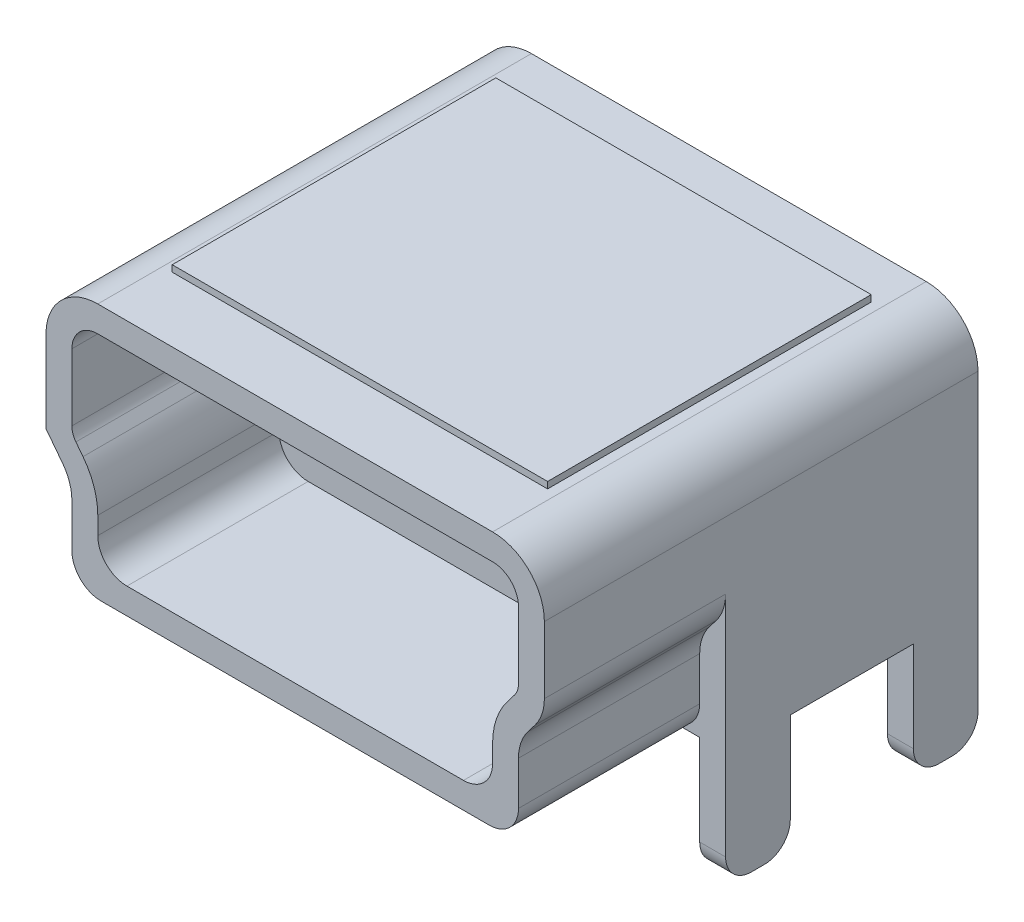
from build123d import *

# Parameters (mm, degrees)
SKETCH1_W              = 7.7
SKETCH1_H              = 6.7
BOSS_EXTRUDE1_DEPTH    = 3.95
SKETCH2_W              = 0.4
SKETCH2_H              = 1
BOSS_EXTRUDE2_DEPTH    = 1.8
FILLET1_R              = 0.4
LPATTERN1_COUNT        = 2
LPATTERN1_PITCH        = 2.9
FILLET1_OF_LPATTERN1_R = 0.4
FILLET2_R              = 0.8
CUT_EXTRUDE1_DEPTH     = 2.8
FILLET3_R              = 0.45
FILLET4_R              = 0.7
CUT_EXTRUDE2_DEPTH     = 2.8
MIRROR3_START          = 0.55
MIRROR3_DEPTH          = 2.8
MIRROR3_START_2        = -2.95
MIRROR3_2_OUTLINE_W    = 0.4
MIRROR3_2_OUTLINE_H    = 1.8
MIRROR3_2_DEPTH        = 0.2
MIRROR3_START_3        = -0.05
MIRROR3_3_OUTLINE_W    = 0.4
MIRROR3_3_OUTLINE_H    = 1.8
MIRROR3_3_DEPTH        = 0.2
MIRROR3_START_4        = -3.85
MIRROR3_4_DEPTH        = 0.4
SKETCH5_W              = 5.8
SKETCH5_H              = 5
BOSS_EXTRUDE3_DEPTH    = 0.1


with BuildPart() as part:
    # Sketch1 → Boss-Extrude1 (new body)
    with BuildSketch(Plane(origin=(0, 0, 0), x_dir=(1, 0, 0), z_dir=(0, 1, 0))):
        Rectangle(SKETCH1_W, SKETCH1_H)
    extrude(amount=BOSS_EXTRUDE1_DEPTH)

    # Sketch2 → Boss-Extrude2 (add)
    with BuildSketch(Plane.XZ):
        with Locations((3.65, -2.85)):
            Rectangle(SKETCH2_W, SKETCH2_H)
    boss_extrude2 = extrude(amount=BOSS_EXTRUDE2_DEPTH)

    # Fillet1
    fillet1_edges = [part.edges().sort_by_distance(p)[0] for p in [
        (3.65, -1.8, -2.35),
        (3.65, -1.8, -3.35),
    ]]
    fillet(fillet1_edges, radius=FILLET1_R)

    # LPattern1: Boss-Extrude2 ×2
    with Locations(*[(0, 0, i * LPATTERN1_PITCH) for i in range(1, LPATTERN1_COUNT)]):
        add(boss_extrude2)

    # Fillet1 of LPattern1
    fillet1_of_lpattern1_edges = [part.edges().sort_by_distance(p)[0] for p in [
        (3.65, -1.8, 0.55),
        (3.65, -1.8, -0.45),
    ]]
    fillet(fillet1_of_lpattern1_edges, radius=FILLET1_OF_LPATTERN1_R)

    # Fillet2
    fillet2_edges = [part.edges().sort_by_distance(p)[0] for p in [
        (3.85, 3.95, 0),
        (-3.85, 3.95, 0),
    ]]
    fillet(fillet2_edges, radius=FILLET2_R)

    # Sketch3 → Cut-Extrude1 (cut)
    with BuildSketch(Plane.XY.offset(3.35)):
        Polygon((3.85, 1.36), (3.85, 1.88), (3.45, 1.36), (3.45, 0), (3.85, 0), align=None)
    extrude(amount=-CUT_EXTRUDE1_DEPTH, mode=Mode.SUBTRACT)

    # Fillet3
    fillet3_edges = [part.edges().sort_by_distance(p)[0] for p in [
        (3.45, 0, 1.95),
    ]]
    fillet(fillet3_edges, radius=FILLET3_R)

    # Fillet4
    fillet4_edges = [part.edges().sort_by_distance(p)[0] for p in [
        (3.45, 1.36, 1.95),
        (3.85, 1.88, 1.95),
    ]]
    fillet(fillet4_edges, radius=FILLET4_R)

    # Sketch4 → Cut-Extrude2 (cut)
    with BuildSketch(Plane.XY.offset(3.35)):
        with BuildLine():
            Line((0, 0.4), (0, 3.55))
            Line((0, 3.55), (3.05, 3.55))
            ThreePointArc((3.05, 3.55), (3.332842712, 3.432842712), (3.45, 3.15))
            Line((3.45, 3.15), (3.45, 2.118085363))
            ThreePointArc((3.45, 2.118085363), (3.434021266, 2.021483497), (3.387787197, 1.935172134))
            Line((3.387787197, 1.935172134), (3.278113612, 1.792596474))
            ThreePointArc((3.278113612, 1.792596474), (3.108588692, 1.476121479), (3.05, 1.121914637))
            Line((3.05, 1.121914637), (3.05, 0.85))
            ThreePointArc((3.05, 0.85), (2.918198052, 0.531801948), (2.6, 0.4))
            Line((2.6, 0.4), (0, 0.4))
        make_face()
    extrude(amount=-CUT_EXTRUDE2_DEPTH, mode=Mode.SUBTRACT)

    # Mirror3: read off the stored shape, not the designer's step
    # Mirror3 outline → Mirror3 (cut)
    with BuildSketch(Plane.XY.offset(MIRROR3_START)):
        with BuildLine():
            Line((-3.85, 1.88), (-3.85, 0))
            Line((-3.85, 0), (-3, 0))
            ThreePointArc((-3, 0), (-3.318198052, 0.131801948), (-3.45, 0.45))
            Line((-3.45, 0.45), (-3.45, 1.121914637))
            ThreePointArc((-3.45, 1.121914637), (-3.487283713, 1.347318991), (-3.595163208, 1.54871217))
            Line((-3.595163208, 1.54871217), (-3.85, 1.88))
        make_face()
        with BuildLine():
            ThreePointArc((-3.05, 0.85), (-2.918198052, 0.531801948), (-2.6, 0.4))
            Line((-2.6, 0.4), (0, 0.4))
            Line((0, 0.4), (0, 3.55))
            Line((0, 3.55), (-3.05, 3.55))
            ThreePointArc((-3.05, 3.55), (-3.332842712, 3.432842712), (-3.45, 3.15))
            Line((-3.45, 3.15), (-3.45, 2.118085363))
            ThreePointArc((-3.45, 2.118085363), (-3.434021266, 2.021483497), (-3.387787197, 1.935172134))
            Line((-3.387787197, 1.935172134), (-3.278113612, 1.792596474))
            ThreePointArc((-3.278113612, 1.792596474), (-3.108588692, 1.476121478), (-3.05, 1.121914637))
            Line((-3.05, 1.121914637), (-3.05, 0.85))
        make_face()
    extrude(amount=MIRROR3_DEPTH, mode=Mode.SUBTRACT)

    # Mirror3 2 outline → Mirror3 2 (add)
    with BuildSketch(Plane.XY.offset(MIRROR3_START_2)):
        with Locations((-3.65, -0.9)):
            Rectangle(MIRROR3_2_OUTLINE_W, MIRROR3_2_OUTLINE_H)
    extrude(amount=MIRROR3_2_DEPTH)

    # Mirror3 3 outline → Mirror3 3 (add)
    with BuildSketch(Plane.XY.offset(MIRROR3_START_3)):
        with Locations((-3.65, -0.9)):
            Rectangle(MIRROR3_3_OUTLINE_W, MIRROR3_3_OUTLINE_H)
    extrude(amount=MIRROR3_3_DEPTH)

    # Mirror3 4 outline → Mirror3 4 (add)
    with BuildSketch(Plane.YZ.offset(MIRROR3_START_4)):
        with BuildLine():
            Line((0, -2.75), (0, -2.35))
            Line((0, -2.35), (-1.4, -2.35))
            ThreePointArc((-1.4, -2.35), (-1.682842712, -2.467157288), (-1.8, -2.75))
            Line((-1.8, -2.75), (0, -2.75))
        make_face()
        with BuildLine():
            Line((-1.8, 0.15), (0, 0.15))
            Line((0, 0.15), (0, 0.55))
            Line((0, 0.55), (-1.4, 0.55))
            ThreePointArc((-1.4, 0.55), (-1.682842712, 0.432842712), (-1.8, 0.15))
        make_face()
        with BuildLine():
            Line((-1.4, -0.45), (0, -0.45))
            Line((0, -0.45), (0, -0.05))
            Line((0, -0.05), (-1.8, -0.05))
            ThreePointArc((-1.8, -0.05), (-1.682842712, -0.332842712), (-1.4, -0.45))
        make_face()
        with BuildLine():
            Line((0, -3.35), (0, -2.95))
            Line((0, -2.95), (-1.8, -2.95))
            ThreePointArc((-1.8, -2.95), (-1.682842712, -3.232842712), (-1.4, -3.35))
            Line((-1.4, -3.35), (0, -3.35))
        make_face()
    extrude(amount=MIRROR3_4_DEPTH)

    # Sketch5 → Boss-Extrude3 (add)
    with BuildSketch(Plane(origin=(0, 3.95, 0), x_dir=(1, 0, 0), z_dir=(0, 1, 0))):
        with Locations((0, 0.15)):
            Rectangle(SKETCH5_W, SKETCH5_H)
    extrude(amount=BOSS_EXTRUDE3_DEPTH)


solid = part.part
